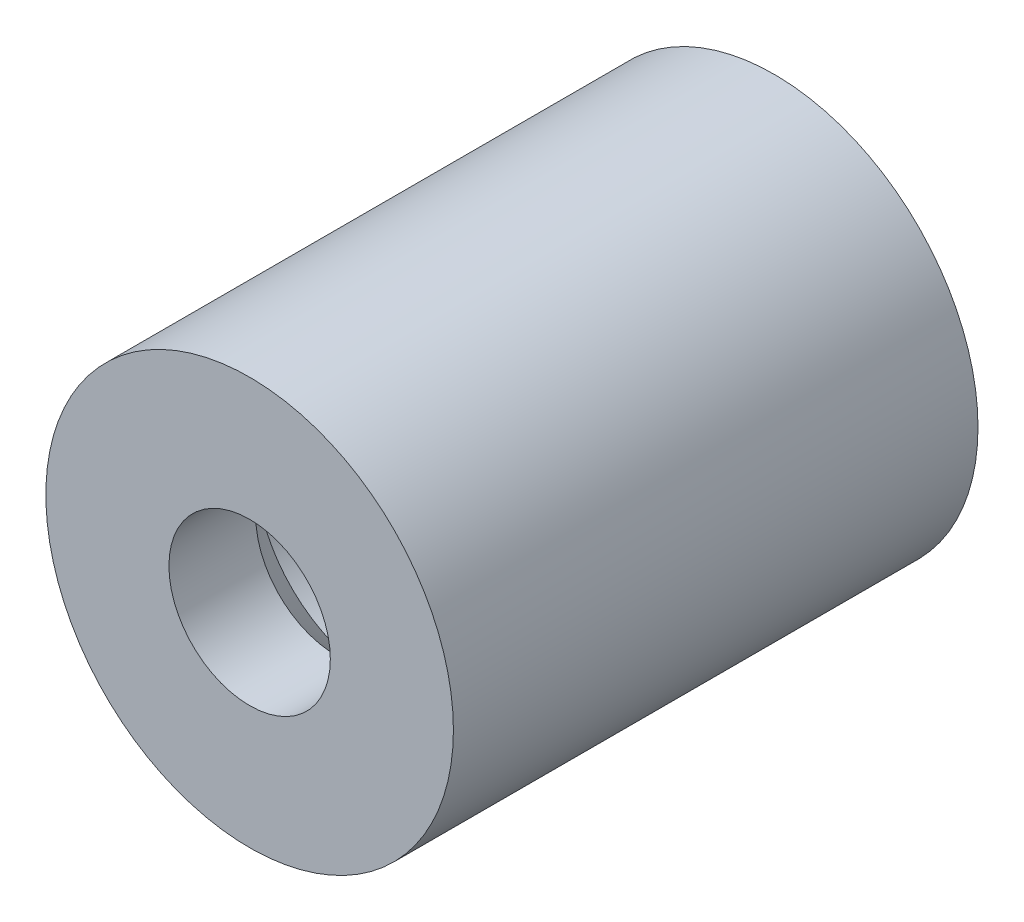
from build123d import *

# Parameters (mm, degrees)
SKETCH1_R               = 5.05
SKETCH1_R_2             = 3.05
BOSS_EXTRUDE1_DEPTH     = 11
BOSS_EXTRUDE2_START     = 11
SKETCH1_3_R             = 5.05
SKETCH1_3_R_2           = 3.05
SKETCH1_3_R_3           = 2
BOSS_EXTRUDE2_DEPTH     = 2
CUT_EXTRUDE1_REACH      = 16.833
CUT_EXTRUDE1_END_RADIUS = 5.05
SKETCH2_R               = 1.6
CHAMFER1_SIZE           = 1.2


with BuildPart() as part:
    # Sketch1 → Boss-Extrude1 (new body)
    with BuildSketch(Plane(origin=(0, 0, 0), x_dir=(0, 1, 0), z_dir=(0, 0, 1))):
        with Locations(Location((0, 0, 0), (0, 0, 270))):
            Circle(SKETCH1_R)
        with Locations(Location((0, 0, 0), (0, 0, 270))):
            Circle(SKETCH1_R_2, mode=Mode.SUBTRACT)
    extrude(amount=BOSS_EXTRUDE1_DEPTH)

    # Sketch1<3> → Boss-Extrude2 (add)
    # profile 1 of 2: a face of its own
    with BuildSketch(Plane(origin=(0, 0, 0), x_dir=(0, 1, 0), z_dir=(0, 0, 1)).offset(BOSS_EXTRUDE2_START)):
        with Locations(Location((0, 0, 0), (0, 0, 270))):
            Circle(SKETCH1_3_R)
        with Locations(Location((0, 0, 0), (0, 0, 270))):
            Circle(SKETCH1_3_R_2, mode=Mode.SUBTRACT)
    # profile 2 of 2: a face of its own
    with BuildSketch(Plane(origin=(0, 0, 0), x_dir=(0, 1, 0), z_dir=(0, 0, 1)).offset(BOSS_EXTRUDE2_START)):
        with Locations(Location((0, 0, 0), (0, 0, 270))):
            Circle(SKETCH1_3_R_2)
        with Locations(Location((0, 0, 0), (0, 0, 270))):
            Circle(SKETCH1_3_R_3, mode=Mode.SUBTRACT)
    extrude(amount=BOSS_EXTRUDE2_DEPTH)

    # Cut-Extrude1: up to this cylinder (the profile starts inside it)
    cut_extrude1_end = Plane(origin=(0, 0, 3), z_dir=(0, 0, -1)) * Cylinder(CUT_EXTRUDE1_END_RADIUS, 44.766, mode=Mode.PRIVATE)
    # Sketch2 → Cut-Extrude1 (cut, up to the surface)
    with BuildSketch(Plane(origin=(0, 0, 0), x_dir=(-1, 0, 0), z_dir=(0, 1, 0)), mode=Mode.PRIVATE) as cut_extrude1_sk1:
        with Locations(Location((0, 3, 0), (0, 0, 90))):
            Circle(SKETCH2_R)
    cut_extrude1_tool1 = extrude(cut_extrude1_sk1.sketch, amount=-CUT_EXTRUDE1_REACH, mode=Mode.PRIVATE) & cut_extrude1_end
    add(cut_extrude1_tool1.solids().sort_by_distance((0, 0, 3))[0], mode=Mode.SUBTRACT)

    # Chamfer1
    # the kernel refuses this chamfer: 1.2 mm, written as the material it adds along each edge
    with BuildSketch(Plane(origin=(0, 0, 11), x_dir=(1, 0, 0), z_dir=(0, -1, 0))) as chamfer1_piece_1_section:
        Polygon((3.05, -CHAMFER1_SIZE), (3.05 - CHAMFER1_SIZE, 0), (3.05, 0), align=None)
    chamfer1_piece_1 = revolve(axis=Axis((0, 0, 11), (0, 0, 1)), mode=Mode.PRIVATE)
    chamfer1_piece_1 = chamfer1_piece_1 - Plane(origin=(0, 0, 10.324643315), x_dir=(1, 0, 0), z_dir=(0, 0, -1)) * Cylinder(2, 13, mode=Mode.PRIVATE)
    add(chamfer1_piece_1)


solid = part.part
